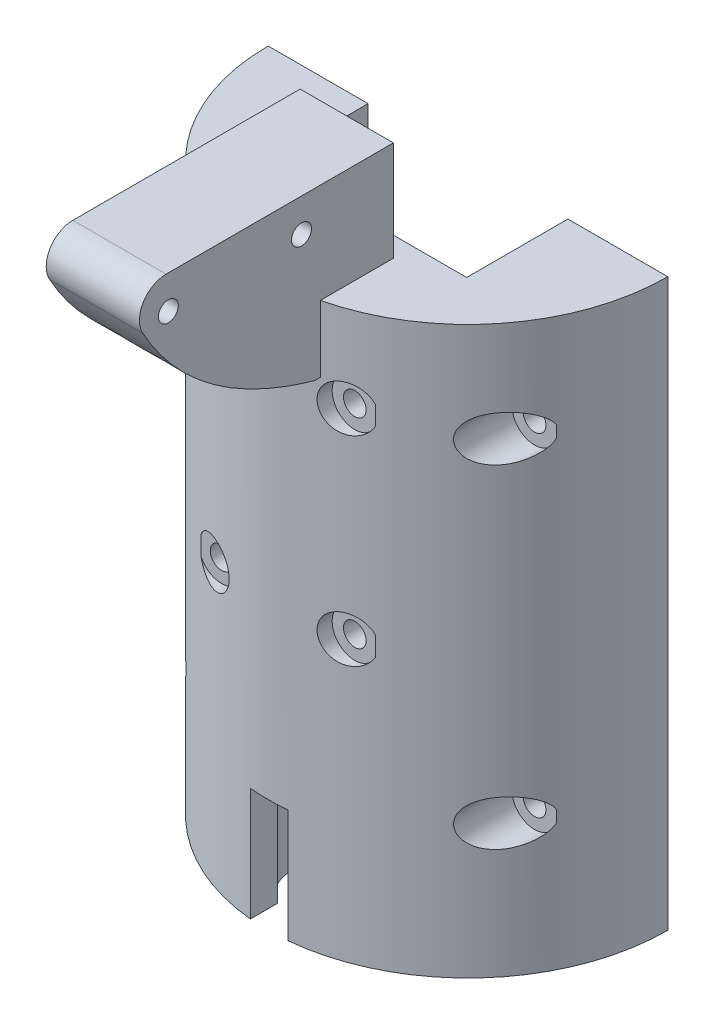
from build123d import *
from build123d.topology import SkipClean

# Parameters (mm, degrees)
EXTRUDE_1_DEPTH      = 80
SKETCH_2_R           = 1.7
CUT_EXTRUDE_1_DEPTH  = 100
SKETCH_3_R           = 1.7
CUT_EXTRUDE_2_DEPTH  = 100
SKETCH_4_R           = 3.4
CUT_EXTRUDE_3_DEPTH  = 26.5
SKETCH_5_R           = 3.4
CUT_EXTRUDE_4_DEPTH  = 13
EXTRUDE_START        = 3
EXTRUDE_2_DEPTH      = 3
EXTRUDE_3_DEPTH      = 9.5
EXTRUDE_4_DEPTH      = 7
SKETCH_14_R          = 1.5
CUT_EXTRUDE_6_DEPTH  = 14
SKETCH_18_W          = 14
SKETCH_18_H          = 3
CUT_EXTRUDE_9_DEPTH  = 20
SKETCH_19_R          = 3
CUT_EXTRUDE_10_DEPTH = 3
FILLET_4_R           = 1
CHAMFER_2_SIZE       = 2
SKETCH_20_R          = 6
CUT_EXTRUDE_11_DEPTH = 15
SKETCH_23_W          = 5.624944444
SKETCH_23_H          = 15.463858562
CUT_EXTRUDE_14_DEPTH = 30
SKETCH_25_W          = 14
SKETCH_25_H          = 41.8
CUT_EXTRUDE_16_DEPTH = 5
FILLET_6_R           = 4
EXTRUDE_START_2      = 2
EXTRUDE_5_DEPTH      = 2
EXTRUDE_6_DEPTH      = 2


# Some blends are built 0.0001 mm under size
with BuildPart() as part:
    # 草图1 → 凸台-拉伸1 (new body)
    with BuildSketch(Plane(origin=(0, 0, 0), x_dir=(1, 0, 0), z_dir=(0, 1, 0))):
        with BuildLine():
            Line((-15, 0), (-30, 0))
            ThreePointArc((-30, 0), (0, -30), (30, 0))
            Line((30, 0), (15, 0))
            Line((15, 0), (15, -15.2))
            Line((15, -15.2), (-15, -15.2))
            Line((-15, -15.2), (-15, 0))
        make_face()
    extrude(amount=EXTRUDE_1_DEPTH)

    # 草图2 → 切除-拉伸1 (cut)
    with BuildSketch(Plane.XY):
        with Locations(Location((-10, 37, 0), (0, 0, 180))):
            Circle(SKETCH_2_R)
        with Locations(Location((-10, 67, 0), (0, 0, 180))):
            Circle(SKETCH_2_R)
        with Locations(Location((10, 37, 0), (0, 0, 180))):
            Circle(SKETCH_2_R)
        with Locations(Location((10, 67, 0), (0, 0, 180))):
            Circle(SKETCH_2_R)
    extrude(amount=CUT_EXTRUDE_1_DEPTH, mode=Mode.SUBTRACT)

    # 草图3 → 切除-拉伸2 (cut)
    with BuildSketch(Plane(origin=(0, 0, 0), x_dir=(-1, 0, 0), z_dir=(0, 0, -1))):
        with Locations((23.5, 65)):
            Circle(SKETCH_3_R)
        with Locations((-23.5, 65)):
            Circle(SKETCH_3_R)
        with Locations((23.5, 15)):
            Circle(SKETCH_3_R)
        with Locations((-23.5, 15)):
            Circle(SKETCH_3_R)
    extrude(amount=-CUT_EXTRUDE_2_DEPTH, mode=Mode.SUBTRACT)

    # 草图4 → 切除-拉伸3 (cut)
    with BuildSketch(Plane(origin=(0, 0, 40), x_dir=(-1, 0, 0), z_dir=(0, 0, -1))):
        with Locations((-23.5, 65)):
            Circle(SKETCH_4_R)
        with Locations((-23.5, 15)):
            Circle(SKETCH_4_R)
        with Locations((23.5, 65)):
            Circle(SKETCH_4_R)
        with Locations((23.5, 15)):
            Circle(SKETCH_4_R)
    extrude(amount=CUT_EXTRUDE_3_DEPTH, mode=Mode.SUBTRACT)

    # 草图5 → 切除-拉伸4 (cut)
    with BuildSketch(Plane(origin=(0, 0, 40), x_dir=(-1, 0, 0), z_dir=(0, 0, -1))):
        with Locations((-10, 37)):
            Circle(SKETCH_5_R)
        with Locations((10, 37)):
            Circle(SKETCH_5_R)
        with Locations((10, 67)):
            Circle(SKETCH_5_R)
        with Locations((-10, 67)):
            Circle(SKETCH_5_R)
    extrude(amount=CUT_EXTRUDE_4_DEPTH, mode=Mode.SUBTRACT)

    # 草图6 → 凸台-拉伸2 (add)
    with SkipClean():  # the faces are left unmerged after this step: merging them gives an invalid solid
        with BuildSketch(Plane.XZ.offset(EXTRUDE_START)):
            with BuildLine():
                Line((-30, 0), (30, 0))
                ThreePointArc((30, 0), (0, 30), (-30, 0))
            make_face()
        extrude(amount=-EXTRUDE_2_DEPTH)

    # 草图7 → 凸台-拉伸3 (add)
    with SkipClean():  # the faces are left unmerged after this step: merging them gives an invalid solid
        with BuildSketch(Plane.XZ.offset(3)):
            with BuildLine():
                Line((-6, 0), (6, 0))
                ThreePointArc((6, 0), (0, 6), (-6, 0))
            make_face()
        extrude(amount=EXTRUDE_3_DEPTH)

    # 草图13 → 凸台-拉伸4 (add, symmetric)
    with SkipClean():  # the faces are left unmerged after this step: merging them gives an invalid solid
        with BuildSketch(Plane(origin=(0, 0, 0), x_dir=(0, 0, -1), z_dir=(1, 0, 0))):
            with BuildLine():
                Line((-15.2, 100), (-60, 100))
                add(Edge.make_bspline(
                    [(-60, 100), (-54.458111129, 76.859605584), (-30, 70)],
                    knots=[0, 0, 0, 1, 1, 1], degree=2))
                Line((-30, 70), (-15.2, 70))
                Line((-15.2, 70), (-15.2, 100))
            make_face()
        extrude(amount=EXTRUDE_4_DEPTH, both=True)

    # 草图14 → 切除-拉伸6 (cut)
    with SkipClean():  # the faces are left unmerged after this step: merging them gives an invalid solid
        with BuildSketch(Plane.ZY.offset(7)):
            with Locations((32, 90)):
                Circle(SKETCH_14_R)
            with Locations((52, 90)):
                Circle(SKETCH_14_R)
        extrude(amount=-CUT_EXTRUDE_6_DEPTH, mode=Mode.SUBTRACT)

    # 草图18 → 切除-拉伸9 (cut)
    with SkipClean():  # the faces are left unmerged after this step: merging them gives an invalid solid
        with BuildSketch(Plane(origin=(0, 100, 0), x_dir=(1, 0, 0), z_dir=(0, 1, 0))):
            with Locations((0, -16.7)):
                Rectangle(SKETCH_18_W, SKETCH_18_H)
        extrude(amount=-CUT_EXTRUDE_9_DEPTH, mode=Mode.SUBTRACT)

    # 草图19 → 切除-拉伸10 (cut)
    with SkipClean():  # the faces are left unmerged after this step: merging them gives an invalid solid
        with BuildSketch(Plane(origin=(0, 0, 0), x_dir=(1, 0, 0), z_dir=(0, 1, 0))):
            Circle(SKETCH_19_R)
        extrude(amount=-CUT_EXTRUDE_10_DEPTH, mode=Mode.SUBTRACT)

    # 圆角4
    # the kernel refuses this fillet: 1 mm, written as the material it adds along each edge
    with BuildSketch(Plane(origin=(0, -3, 0), x_dir=(-1, 0, 0), z_dir=(0, 0, -1))) as fillet_4_piece_1:
        with BuildLine():
            CenterArc((3 - FILLET_4_R, FILLET_4_R), FILLET_4_R, 270, 90)
            Line((3 - FILLET_4_R, 0), (3, 0))
            Line((3, 0), (3, FILLET_4_R))
        make_face()
    revolve(axis=Axis((0, -3, 0), (0, 1, 0)), revolution_arc=180)

    # 倒角2
    chamfer_2_edges = [part.edges().sort_by_distance(p)[0] for p in [
        (0, 0, 3),
    ]]
    chamfer(chamfer_2_edges, length=CHAMFER_2_SIZE - 0.0001)  # a hair under: the kernel refuses the full size

    # 草图20 → 切除-拉伸11 (cut)
    with BuildSketch(Plane.XZ.offset(3)):
        with Locations(Location((0, 20.5, 0), (0, 0, 270))):
            Circle(SKETCH_20_R)
    extrude(amount=-CUT_EXTRUDE_11_DEPTH, mode=Mode.SUBTRACT)

    # 草图23 → 切除-拉伸14 (cut)
    with BuildSketch(Plane(origin=(0, 0, 15.2), x_dir=(-1, 0, 0), z_dir=(0, 0, -1))):
        with Locations((0, 4.268070719)):
            Rectangle(SKETCH_23_W, SKETCH_23_H)
    extrude(amount=-CUT_EXTRUDE_14_DEPTH, mode=Mode.SUBTRACT)

    # 草图25 → 切除-拉伸16 (cut)
    with BuildSketch(Plane(origin=(0, 100, 0), x_dir=(1, 0, 0), z_dir=(0, 1, 0))):
        with Locations((0, -39.1)):
            Rectangle(SKETCH_25_W, SKETCH_25_H)
    extrude(amount=-CUT_EXTRUDE_16_DEPTH, mode=Mode.SUBTRACT)

    # 圆角6
    fillet_6_edges = [part.edges().sort_by_distance(p)[0] for p in [
        (3.4999997, 95, 58.513859135),
    ]]
    fillet(fillet_6_edges, radius=FILLET_6_R)

    # 草图26 → 凸台-拉伸5 (add)
    with BuildSketch(Plane.XZ.offset(3).offset(EXTRUDE_START_2)):
        with BuildLine():
            ThreePointArc((30, 0), (22.185289796, 20.194378343), (2.812472222, 29.86787572))
            Line((2.812472222, 29.86787572), (2.812472222, 25.8))
            ThreePointArc((2.812472222, 25.8), (0, 14.5), (-2.812472222, 25.8))
            Line((-2.812472222, 25.8), (-2.812472222, 29.86787572))
            ThreePointArc((-2.812472222, 29.86787572), (-22.185289796, 20.194378343), (-30, 0))
            Line((-30, 0), (-6, 0))
            ThreePointArc((-6, 0), (0, 6), (6, 0))
            Line((6, 0), (30, 0))
        make_face()
    extrude(amount=-EXTRUDE_5_DEPTH)

    # 草图27 → 凸台-拉伸6 (add)
    with BuildSketch(Plane.XZ.offset(12.5)):
        with BuildLine():
            Line((-6, 0), (6, 0))
            ThreePointArc((6, 0), (0, 6), (-6, 0))
        make_face()
    extrude(amount=EXTRUDE_6_DEPTH)


solid = part.part
